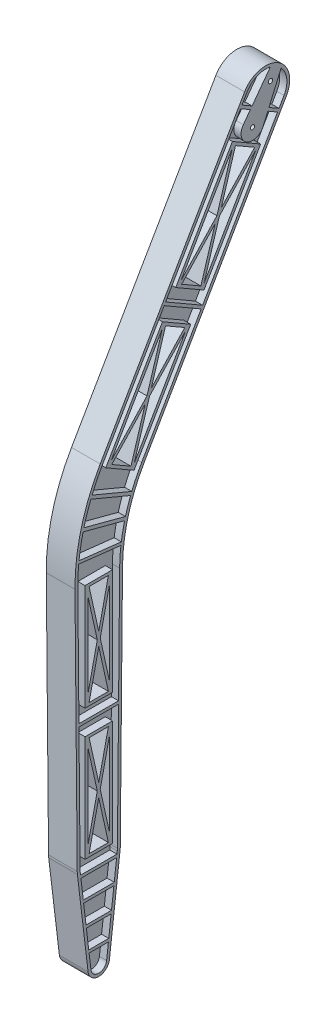
from build123d import *

# Parameters (mm, degrees)
BOSS_EXTRUDE2_DEPTH  = 20
FILLET1_R            = 150
FILLET2_R            = 175
SKETCH3_R            = 1.5
CUT_EXTRUDE1_DEPTH   = 658.655406836
SKETCH2_R            = 1.5
CUT_EXTRUDE3_DEPTH   = 658.655406836
SKETCH5_W            = 20.16233043
SKETCH5_H            = 215
CUT_EXTRUDE4_DEPTH   = 658.655406836
SCALE1_SCALE         = 0.75
BOSS_EXTRUDE3_DEPTH  = 15
SKETCH8_R            = 1.5
CUT_EXTRUDE5_DEPTH   = 571.609018885
SKETCH9_W            = 5
SKETCH9_H            = 487.176487801
CUT_EXTRUDE6_DEPTH   = 573.004632355
SKETCH11_W           = 15.121747822
SKETCH11_H           = 161.25
BOSS_EXTRUDE4_DEPTH  = 10
SKETCH13_W           = 15.121747822
SKETCH13_H           = 70
CUT_EXTRUDE7_DEPTH   = 10
BOSS_EXTRUDE5_START  = 5
SKETCH18_R           = 1.5
SKETCH18_W           = 15.121747822
SKETCH18_H           = 70
BOSS_EXTRUDE5_DEPTH  = 5
SKETCH19_R           = 3.5
SKETCH19_W           = 19.121747822
SKETCH19_H           = 74
CUT_EXTRUDE8_DEPTH   = 5
SKETCH21_R           = 1.5
SKETCH21_W           = 15.121747822
SKETCH21_H           = 70
BOSS_EXTRUDE6_DEPTH  = 5
CUT_EXTRUDE9_START   = -5
SKETCH22_R           = 3.5
SKETCH22_W           = 19.121747822
SKETCH22_H           = 74
CUT_EXTRUDE9_DEPTH   = 5
BOSS_EXTRUDE12_DEPTH = 5
BOSS_EXTRUDE13_DEPTH = 5
BOSS_EXTRUDE14_DEPTH = 20
SKETCH28_R           = 1.5
BOSS_EXTRUDE17_DEPTH = 20


with BuildPart() as part:
    # Sketch1 → Boss-Extrude2 (new body)
    with BuildSketch(Plane(origin=(0, 0, 0), x_dir=(0, 0, -1), z_dir=(1, 0, 0))):
        with BuildLine():
            Line((-19.485571585, 11.25), (-174.485571585, -257.217875173))
            ThreePointArc((-174.485571585, -257.217875173), (-176.706128156, -262.543856228), (-177.499034811, -268.259470344))
            Line((-177.499034811, -268.259470344), (-175, -538.467875173))
            ThreePointArc((-175, -538.467875173), (-174.964893244, -539.652374115), (-174.859696226, -540.832714666))
            Line((-174.859696226, -540.832714666), (-164.929848113, -624.222630857))
            ThreePointArc((-164.929848113, -624.222630857), (-155, -633.040211111), (-145.070151887, -624.222630857))
            Line((-145.070151887, -624.222630857), (-135.140303774, -540.832714666))
            ThreePointArc((-135.140303774, -540.832714666), (-135.035106756, -539.652374115), (-135, -538.467875173))
            Line((-135, -538.467875173), (-132.55577389, -274.593335215))
            Line((-132.55577389, -274.593335215), (19.485571585, -11.25))
            ThreePointArc((19.485571585, -11.25), (11.25, 19.485571585), (-19.485571585, 11.25))
        make_face()
    extrude(amount=BOSS_EXTRUDE2_DEPTH)

    # Fillet1
    fillet1_edges = [part.edges().sort_by_distance(p)[0] for p in [
        (10, -274.593335215, 132.55577389),
    ]]
    fillet(fillet1_edges, radius=FILLET1_R)

    # Fillet2
    # the kernel refuses this fillet: 175 mm, written as the material it takes off along each edge
    with BuildSketch(Plane(origin=(-131.939936162, -268.259470344, 177.499034811), x_dir=(0, 0.8922863830358696, -0.4514698335977339), z_dir=(1, 0, 0))) as fillet2_piece_1:
        with BuildLine():
            CenterArc((43.123176313, -174.733578593), FILLET2_R, 86.83802612, 30.529887534)
            Line((-37.324765569, -19.320809983), (-45.369559757, -3.779533122))
            Line((-45.369559757, -3.779533122), (-8.044794188, 15.541276861))
            Line((-8.044794188, 15.541276861), (-7.755750109, 15.687521801))
            ThreePointArc((-7.755750109, 15.687521801), (12.178032575, 19.769432792), (53.74125428, 17.473357859))
            Line((53.74125428, 17.473357859), (52.775974465, 0))
        make_face()
    extrude(amount=283.879872325, mode=Mode.SUBTRACT)

    # Sketch3 → Cut-Extrude1 (cut, through all)
    with BuildSketch(Plane(origin=(20, 0, 0), x_dir=(0, 0, -1), z_dir=(1, 0, 0))):
        with Locations((5.625, 9.742785793)):
            Circle(SKETCH3_R)
    extrude(amount=-CUT_EXTRUDE1_DEPTH, mode=Mode.SUBTRACT)

    # Sketch2 → Cut-Extrude3 (cut, through all)
    with BuildSketch(Plane(origin=(20, 0, 0), x_dir=(0, 0, -1), z_dir=(1, 0, 0))):
        with Locations((-6.375, -11.041823898)):
            Circle(SKETCH2_R)
    extrude(amount=-CUT_EXTRUDE3_DEPTH, mode=Mode.SUBTRACT)

    # Sketch5 → Cut-Extrude4 (cut, through all)
    with BuildSketch(Plane(origin=(20, 0, 0), x_dir=(0, 0, -1), z_dir=(1, 0, 0))):
        Polygon((-29.825317547, -26.658965344), (-8.174682453, -39.158965344), (-123.174682453, -238.344808214), (-144.825317547, -225.844808214), align=None)
        with Locations((-154.999937682, -422.152374115)):
            Rectangle(SKETCH5_W, SKETCH5_H)
    extrude(amount=-CUT_EXTRUDE4_DEPTH, mode=Mode.SUBTRACT)


with BuildPart() as part_1:
    # Scale1: scaled about (10, -289.172270354, 114.625311111)
    add(part.part.scale(SCALE1_SCALE).moved(Location((2.5, -72.293067588, 28.656327778))))

    # Sketch7 → Boss-Extrude3 (add, through all)
    with BuildSketch(Plane(origin=(17.5, 0, 0), x_dir=(0, 0, -1), z_dir=(1, 0, 0))):
        Polygon((-42.981370529, -81.656829208), (-30.518730331, -88.852137881), (-17.366180696, -66.071253666), (-29.828820894, -58.875944992), align=None)
    extrude(amount=-BOSS_EXTRUDE3_DEPTH)

    # Sketch8 → Cut-Extrude5 (cut, through all)
    with BuildSketch(Plane(origin=(17.5, 0, 0), x_dir=(0, 0, -1), z_dir=(1, 0, 0))):
        with Locations((-25.218827778, -66.339142937)):
            Circle(SKETCH8_R)
        with Locations((-37.718827778, -87.989778032)):
            Circle(SKETCH8_R)
    extrude(amount=-CUT_EXTRUDE5_DEPTH, mode=Mode.SUBTRACT)

    # Sketch9 → Cut-Extrude6 (cut, through all)
    with BuildSketch(Plane(origin=(0, 2.77278702, 4.802607998), x_dir=(1, 0, 0), z_dir=(0, 0.5000000000000001, 0.8660254037844387))):
        with Locations((15, -303.649040839)):
            Rectangle(SKETCH9_W, SKETCH9_H)
    extrude(amount=-CUT_EXTRUDE6_DEPTH, mode=Mode.SUBTRACT)

    # Sketch11 → Boss-Extrude4 (add)
    with BuildSketch(Plane(origin=(12.5, 0, 0), x_dir=(0, 0, -1), z_dir=(1, 0, 0))):
        Polygon((-137.275315938, -241.676673749), (-121.037339617, -251.051673749), (-34.787339617, -101.662291596), (-51.025315938, -92.287291596), align=None)
        with Locations((-144.906281039, -388.907348175)):
            Rectangle(SKETCH11_W, SKETCH11_H)
    extrude(amount=-BOSS_EXTRUDE4_DEPTH)

    # Sketch13 → Cut-Extrude7 (cut)
    with BuildSketch(Plane(origin=(12.5, 0, 0), x_dir=(0, 0, -1), z_dir=(1, 0, 0))):
        Polygon((-137.275315938, -241.676673749), (-121.037339617, -251.051673749), (-83.537339617, -186.099768465), (-99.775315938, -176.724768465), align=None)
        with Locations((-144.906281039, -434.532348175)):
            Rectangle(SKETCH13_W, SKETCH13_H)
        Polygon((-51.025315938, -92.287291596), (-34.787339617, -101.662291596), (-72.287339617, -166.61419688), (-88.525315938, -157.23919688), align=None)
        with Locations((-144.906281039, -343.282348175)):
            Rectangle(SKETCH13_W, SKETCH13_H)
    extrude(amount=-CUT_EXTRUDE7_DEPTH, mode=Mode.SUBTRACT)

    # Sketch18 → Boss-Extrude5 (add)
    with BuildSketch(Plane.ZY.offset(-2.5).offset(BOSS_EXTRUDE5_START)):
        with BuildLine():
            Line((159.906327778, -476.143973968), (161.489086418, -305.008027548))
            ThreePointArc((161.489086418, -305.008027548), (157.178190121, -270.410807515), (143.910533579, -238.169207822))
            Line((143.910533579, -238.169207822), (43.270506467, -63.855567589))
            ThreePointArc((43.270506467, -63.855567589), (20.218827778, -57.6788889), (14.042149089, -80.730567589))
            Line((14.042149089, -80.730567589), (113.279885573, -252.615369207))
            ThreePointArc((113.279885573, -252.615369207), (124.382668429, -279.245274482), (128.347201702, -307.823345062))
            Line((128.347201702, -307.823345062), (129.906327778, -476.143973968))
            ThreePointArc((129.906327778, -476.143973968), (129.932657845, -477.032348175), (130.011555609, -477.917603588))
            Line((130.011555609, -477.917603588), (137.458941693, -540.460040732))
            ThreePointArc((137.458941693, -540.460040732), (144.906327778, -547.073225922), (152.353713862, -540.460040732))
            Line((152.353713862, -540.460040732), (159.801099947, -477.917603588))
            ThreePointArc((159.801099947, -477.917603588), (159.879997711, -477.032348175), (159.906327778, -476.143973968))
        make_face()
        with Locations(Location((25.218827778, -66.339142937, 0), (0, 0, 180))):
            Circle(SKETCH18_R, mode=Mode.SUBTRACT)
        with Locations(Location((37.718827778, -87.989778032, 0), (0, 0, 180))):
            Circle(SKETCH18_R, mode=Mode.SUBTRACT)
        Polygon((88.525315938, -157.23919688), (72.287339617, -166.61419688), (34.787339617, -101.662291596), (51.025315938, -92.287291596), align=None, mode=Mode.SUBTRACT)
        Polygon((137.275315938, -241.676673749), (121.037339617, -251.051673749), (83.537339617, -186.099768465), (99.775315938, -176.724768465), align=None, mode=Mode.SUBTRACT)
        with Locations((144.906281039, -343.282348175)):
            Rectangle(SKETCH18_W, SKETCH18_H, mode=Mode.SUBTRACT)
        with Locations((144.906281039, -434.532348175)):
            Rectangle(SKETCH18_W, SKETCH18_H, mode=Mode.SUBTRACT)
    extrude(amount=-BOSS_EXTRUDE5_DEPTH)

    # Sketch19 → Cut-Extrude8 (cut)
    with BuildSketch(Plane.ZY.offset(2.5)):
        with BuildLine():
            Line((131.997525231, -477.681119639), (139.444911316, -540.223556782))
            ThreePointArc((139.444911316, -540.223556782), (144.906327778, -545.073225922), (150.36774424, -540.223556782))
            Line((150.36774424, -540.223556782), (157.815130324, -477.681119639))
            ThreePointArc((157.815130324, -477.681119639), (157.883771696, -476.909447245), (157.906324719, -476.135056334))
            Line((157.906324719, -476.135056334), (159.489171949, -304.989531248))
            ThreePointArc((159.489171949, -304.989531248), (155.2439655, -270.919506948), (142.178482771, -239.169207822))
            Line((142.178482771, -239.169207822), (41.538455659, -64.855567589))
            ThreePointArc((41.538455659, -64.855567589), (21.218827778, -59.410939707), (15.774199896, -79.730567589))
            Line((15.774199896, -79.730567589), (115.01193638, -251.615369207))
            ThreePointArc((115.01193638, -251.615369207), (126.312102043, -278.718695021), (130.347115907, -307.804820189))
            Line((130.347115907, -307.804820189), (131.906330846, -476.135042558))
            ThreePointArc((131.906330846, -476.135042558), (131.928883453, -476.909440369), (131.997525231, -477.681119639))
        make_face()
        with Locations((25.218827778, -66.339142937)):
            Circle(SKETCH19_R, mode=Mode.SUBTRACT)
        with Locations((37.718827778, -87.989778032)):
            Circle(SKETCH19_R, mode=Mode.SUBTRACT)
        Polygon((71.55528881, -169.346247688), (91.257366746, -157.971247688), (51.757366746, -89.555240789), (32.05528881, -100.930240789), align=None, mode=Mode.SUBTRACT)
        Polygon((100.507366746, -173.992717658), (80.80528881, -185.367717658), (120.30528881, -253.783724557), (140.007366746, -242.408724557), align=None, mode=Mode.SUBTRACT)
        with Locations((144.906281039, -343.282348175)):
            Rectangle(SKETCH19_W, SKETCH19_H, mode=Mode.SUBTRACT)
        with Locations((144.906281039, -434.532348175)):
            Rectangle(SKETCH19_W, SKETCH19_H, mode=Mode.SUBTRACT)
    extrude(amount=-CUT_EXTRUDE8_DEPTH, mode=Mode.SUBTRACT)

    # Sketch21 → Boss-Extrude6 (add)
    with BuildSketch(Plane(origin=(12.5, 0, 0), x_dir=(0, 0, -1), z_dir=(1, 0, 0))):
        with BuildLine():
            Line((-43.270506467, -63.855567589), (-143.910533579, -238.169207822))
            ThreePointArc((-143.910533579, -238.169207822), (-157.178190121, -270.410807515), (-161.489086418, -305.008027548))
            Line((-161.489086418, -305.008027548), (-159.906327778, -476.143973968))
            ThreePointArc((-159.906327778, -476.143973968), (-159.879997711, -477.032348175), (-159.801099947, -477.917603588))
            Line((-159.801099947, -477.917603588), (-152.353713862, -540.460040732))
            ThreePointArc((-152.353713862, -540.460040732), (-144.906327778, -547.073225922), (-137.458941693, -540.460040732))
            Line((-137.458941693, -540.460040732), (-130.011555609, -477.917603588))
            ThreePointArc((-130.011555609, -477.917603588), (-129.932657845, -477.032348175), (-129.906327778, -476.143973968))
            Line((-129.906327778, -476.143973968), (-128.347201702, -307.823345062))
            ThreePointArc((-128.347201702, -307.823345062), (-124.382668429, -279.245274482), (-113.279885573, -252.615369207))
            Line((-113.279885573, -252.615369207), (-14.042149089, -80.730567589))
            ThreePointArc((-14.042149089, -80.730567589), (-20.218827778, -57.6788889), (-43.270506467, -63.855567589))
        make_face()
        with Locations((-25.218827778, -66.339142937)):
            Circle(SKETCH21_R, mode=Mode.SUBTRACT)
        with Locations((-37.718827778, -87.989778032)):
            Circle(SKETCH21_R, mode=Mode.SUBTRACT)
        Polygon((-137.275315938, -241.676673749), (-121.037339617, -251.051673749), (-83.537339617, -186.099768465), (-99.775315938, -176.724768465), align=None, mode=Mode.SUBTRACT)
        Polygon((-88.525315938, -157.23919688), (-72.287339617, -166.61419688), (-34.787339617, -101.662291596), (-51.025315938, -92.287291596), align=None, mode=Mode.SUBTRACT)
        with Locations((-144.906281039, -343.282348175)):
            Rectangle(SKETCH21_W, SKETCH21_H, mode=Mode.SUBTRACT)
        with Locations((-144.906281039, -434.532348175)):
            Rectangle(SKETCH21_W, SKETCH21_H, mode=Mode.SUBTRACT)
    extrude(amount=BOSS_EXTRUDE6_DEPTH)

    # Sketch22 → Cut-Extrude9 (cut)
    with BuildSketch(Plane(origin=(17.5, 0, 0), x_dir=(0, 0, -1), z_dir=(1, 0, 0)).offset(CUT_EXTRUDE9_START)):
        with BuildLine():
            Line((-157.815130324, -477.681119639), (-150.36774424, -540.223556782))
            ThreePointArc((-150.36774424, -540.223556782), (-144.906327778, -545.073225922), (-139.444911316, -540.223556782))
            Line((-139.444911316, -540.223556782), (-131.997525231, -477.681119639))
            ThreePointArc((-131.997525231, -477.681119639), (-131.928883453, -476.909440369), (-131.906330846, -476.135042558))
            Line((-131.906330846, -476.135042558), (-130.347115907, -307.804820189))
            ThreePointArc((-130.347115907, -307.804820189), (-126.312102043, -278.718695021), (-115.01193638, -251.615369207))
            Line((-115.01193638, -251.615369207), (-15.774199896, -79.730567589))
            ThreePointArc((-15.774199896, -79.730567589), (-21.218827778, -59.410939707), (-41.538455659, -64.855567589))
            Line((-41.538455659, -64.855567589), (-142.178482771, -239.169207822))
            ThreePointArc((-142.178482771, -239.169207822), (-155.2439655, -270.919506948), (-159.489171949, -304.989531248))
            Line((-159.489171949, -304.989531248), (-157.906324719, -476.135056334))
            ThreePointArc((-157.906324719, -476.135056334), (-157.883771696, -476.909447245), (-157.815130324, -477.681119639))
        make_face()
        with Locations(Location((-25.218827778, -66.339142937, 0), (0, 0, 180))):
            Circle(SKETCH22_R, mode=Mode.SUBTRACT)
        with Locations(Location((-37.718827778, -87.989778032, 0), (0, 0, 180))):
            Circle(SKETCH22_R, mode=Mode.SUBTRACT)
        Polygon((-91.257366746, -157.971247688), (-71.55528881, -169.346247688), (-32.05528881, -100.930240789), (-51.757366746, -89.555240789), align=None, mode=Mode.SUBTRACT)
        Polygon((-140.007366746, -242.408724557), (-120.30528881, -253.783724557), (-80.80528881, -185.367717658), (-100.507366746, -173.992717658), align=None, mode=Mode.SUBTRACT)
        with Locations((-144.906281039, -343.282348175)):
            Rectangle(SKETCH22_W, SKETCH22_H, mode=Mode.SUBTRACT)
        with Locations((-144.906281039, -434.532348175)):
            Rectangle(SKETCH22_W, SKETCH22_H, mode=Mode.SUBTRACT)
    extrude(amount=CUT_EXTRUDE9_DEPTH, mode=Mode.SUBTRACT)

    # Sketch25 → Boss-Extrude12 (add)
    with BuildSketch(Plane(origin=(17.5, 0, 0), x_dir=(0, 0, -1), z_dir=(1, 0, 0))):
        Polygon((-72.524199896, -178.024450918), (-73.524199896, -179.756501726), (-99.288455659, -164.881501726), (-98.288455659, -163.149450918), align=None)
        Polygon((-20.274199896, -87.524796223), (-19.274199896, -85.792745415), (-45.038455659, -70.917745415), (-46.038455659, -72.649796223), align=None)
        Polygon((-131.104144448, -389.532348175), (-131.085618779, -387.532348175), (-158.725770925, -387.532348175), (-158.707273833, -389.532348175), align=None)
        Polygon((-157.356536334, -481.532348175), (-157.594690983, -479.532348175), (-132.217964572, -479.532348175), (-132.456119221, -481.532348175), align=None)
        Polygon((-134.361356414, -497.532348175), (-134.123201765, -495.532348175), (-155.689453791, -495.532348175), (-155.451299142, -497.532348175), align=None)
        Polygon((-136.266593606, -513.532348175), (-136.028438957, -511.532348175), (-153.784216598, -511.532348175), (-153.546061949, -513.532348175), align=None)
        Polygon((-138.171830799, -529.532348175), (-137.93367615, -527.532348175), (-151.878979406, -527.532348175), (-151.640824757, -529.532348175), align=None)
        Polygon((-150.840173753, -256.010920934), (-149.978864856, -253.953349682), (-121.415268721, -265.910203878), (-122.276577617, -267.96777513), align=None)
        Polygon((-156.686574497, -272.99795707), (-156.09555271, -270.765208098), (-125.88485269, -278.762158103), (-126.475874477, -280.994907075), align=None)
        Polygon((-159.207376038, -289.099490832), (-159.433562381, -291.07054325), (-128.714422884, -294.595690406), (-128.488236541, -292.624637987), align=None)
    extrude(amount=-BOSS_EXTRUDE12_DEPTH)

    # Sketch26 → Boss-Extrude13 (add)
    with BuildSketch(Plane.ZY.offset(2.5)):
        Polygon((20.274199896, -87.524796223), (19.274199896, -85.792745415), (45.038455659, -70.917745415), (46.038455659, -72.649796223), align=None)
        Polygon((72.524199896, -178.024450918), (73.524199896, -179.756501726), (99.288455659, -164.881501726), (98.288455659, -163.149450918), align=None)
        Polygon((149.978864856, -253.953349682), (121.415268721, -265.910203878), (122.276577617, -267.96777513), (150.840173753, -256.010920934), align=None)
        Polygon((156.686574497, -272.99795707), (156.09555271, -270.765208098), (125.88485269, -278.762158103), (126.475874477, -280.994907075), align=None)
        Polygon((128.488236541, -292.624637987), (128.714422884, -294.595690406), (159.433562381, -291.07054325), (159.207376038, -289.099490832), align=None)
        Polygon((131.104144448, -389.532348175), (131.085618779, -387.532348175), (158.725770925, -387.532348175), (158.707273833, -389.532348175), align=None)
        Polygon((132.456119221, -481.532348175), (132.217964572, -479.532348175), (157.594690983, -479.532348175), (157.356536334, -481.532348175), align=None)
        Polygon((134.361356414, -497.532348175), (134.123201765, -495.532348175), (155.689453791, -495.532348175), (155.451299142, -497.532348175), align=None)
        Polygon((136.266593606, -513.532348175), (136.028438957, -511.532348175), (153.784216598, -511.532348175), (153.546061949, -513.532348175), align=None)
        Polygon((151.640824757, -529.532348175), (151.878979406, -527.532348175), (137.93367615, -527.532348175), (138.171830799, -529.532348175), align=None)
    extrude(amount=-BOSS_EXTRUDE13_DEPTH)

    # Sketch27 → Boss-Extrude14 (add)
    with BuildSketch(Plane.ZY.offset(2.5)):
        Polygon((49.594991341, -93.113089888), (59.45597393, -125.63961958), (36.217664215, -100.836493305), (34.787339617, -101.662291596), (35.649019561, -103.154765039), (60.767038275, -129.964175772), (71.425659674, -165.121723438), (72.287339617, -166.61419688), (73.717664215, -165.788398589), (63.856681625, -133.261868897), (87.094991341, -158.064995171), (88.525315938, -157.23919688), (87.663635994, -155.746723438), (62.545617281, -128.937312704), (51.886995882, -93.779765039), (51.025315938, -92.287291596), align=None)
        Polygon((98.344991341, -177.550566757), (108.20597393, -210.077096449), (84.967664215, -185.273970174), (83.537339617, -186.099768465), (84.399019561, -187.592241908), (109.517038275, -214.401652641), (120.175659674, -249.559200307), (121.037339617, -251.051673749), (122.467664215, -250.225875458), (112.606681625, -217.699345766), (135.844991341, -242.50247204), (137.275315938, -241.676673749), (136.413635994, -240.184200307), (111.295617281, -213.374789573), (100.636995882, -178.217241908), (99.775315938, -176.724768465), align=None)
        Polygon((138.177245763, -308.282348175), (144.906281039, -338.65869357), (151.635316315, -308.282348175), (152.46715495, -308.282348175), (152.46715495, -313.774554807), (145.930523242, -343.282348175), (152.46715495, -372.790141543), (152.46715495, -378.282348175), (151.635316315, -378.282348175), (144.906281039, -347.90600278), (138.177245763, -378.282348175), (137.345407128, -378.282348175), (137.345407128, -372.790141543), (143.882038836, -343.282348175), (137.345407128, -313.774554807), (137.345407128, -308.282348175), align=None)
        Polygon((138.177245763, -399.532348175), (144.906281039, -429.90869357), (151.635316315, -399.532348175), (152.46715495, -399.532348175), (152.46715495, -405.024554807), (145.930523242, -434.532348175), (152.46715495, -464.040141543), (152.46715495, -469.532348175), (151.635316315, -469.532348175), (144.906281039, -439.15600278), (138.177245763, -469.532348175), (137.345407128, -469.532348175), (137.345407128, -464.040141543), (143.882038836, -434.532348175), (137.345407128, -405.024554807), (137.345407128, -399.532348175), align=None)
    extrude(amount=-BOSS_EXTRUDE14_DEPTH)

    # Sketch28 → Boss-Extrude17 (add)
    with BuildSketch(Plane.ZY.offset(2.5)):
        with BuildLine():
            Line((29.265269405, -63.139479224), (44.147031008, -83.227614319))
            ThreePointArc((44.147031008, -83.227614319), (41.718827778, -94.917981262), (30.38057141, -91.175683474))
            Line((30.38057141, -91.175683474), (20.424616905, -68.243632325))
            Line((20.424616905, -68.243632325), (16.918911988, -60.168765729))
            ThreePointArc((16.918911988, -60.168765729), (20.218827778, -57.6788889), (24.025082259, -56.06601641))
            Line((24.025082259, -56.06601641), (29.265269405, -63.139479224))
        make_face()
        with Locations(Location((25.218827778, -66.339142937, 0), (0, 0, 180))):
            Circle(SKETCH28_R, mode=Mode.SUBTRACT)
        with Locations(Location((37.718827778, -87.989778032, 0), (0, 0, 180))):
            Circle(SKETCH28_R, mode=Mode.SUBTRACT)
    extrude(amount=-BOSS_EXTRUDE17_DEPTH)


solid = part_1.part
